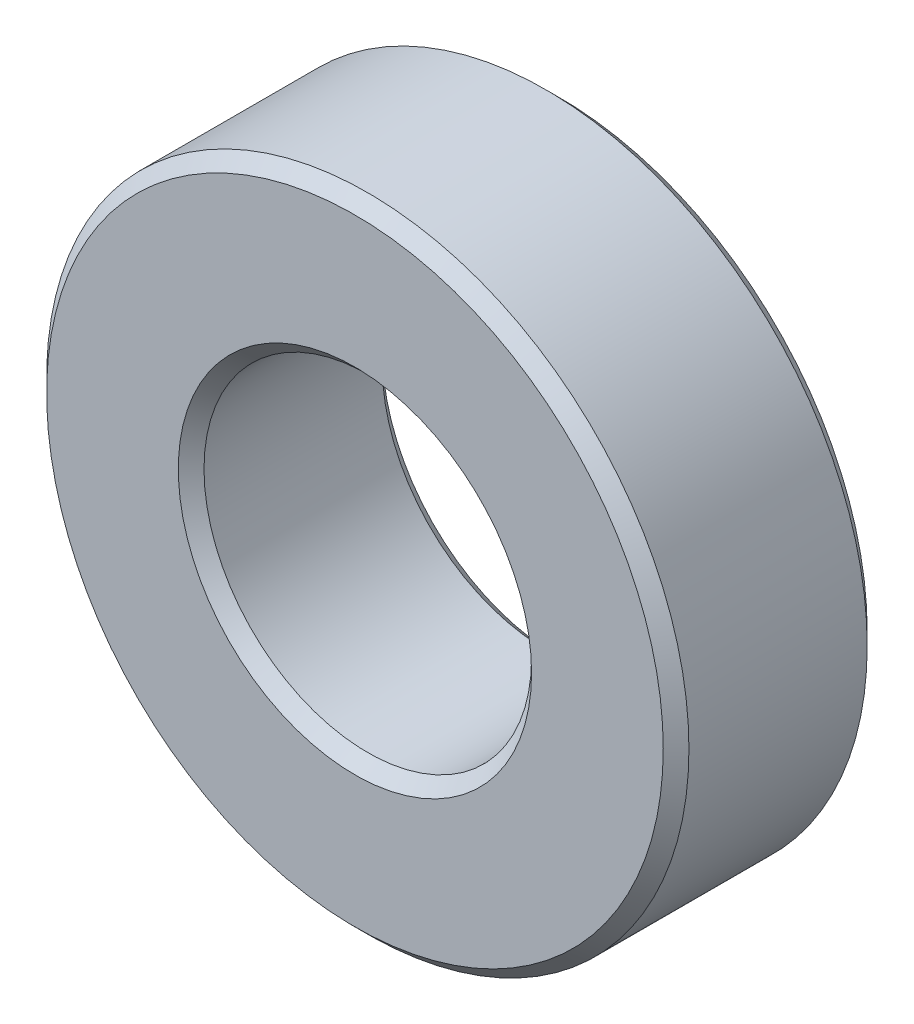
from build123d import *

# Parameters (mm, degrees)
SKETCH1_R           = 5
SKETCH1_R_2         = 2.55
BOSS_EXTRUDE1_DEPTH = 3.175
CHAMFER1_SIZE       = 0.2


with BuildPart() as part:
    # Sketch1 → Boss-Extrude1 (new body)
    with BuildSketch(Plane.XY):
        Circle(SKETCH1_R)
        Circle(SKETCH1_R_2, mode=Mode.SUBTRACT)
    extrude(amount=BOSS_EXTRUDE1_DEPTH)

    # Chamfer1
    chamfer1_edges = [part.edges().sort_by_distance(p)[0] for p in [
        (-5, 0, 0),
        (-2.55, 0, 0),
        (-2.55, 0, 3.175),
        (-5, 0, 3.175),
    ]]
    chamfer(chamfer1_edges, length=CHAMFER1_SIZE)


solid = part.part
